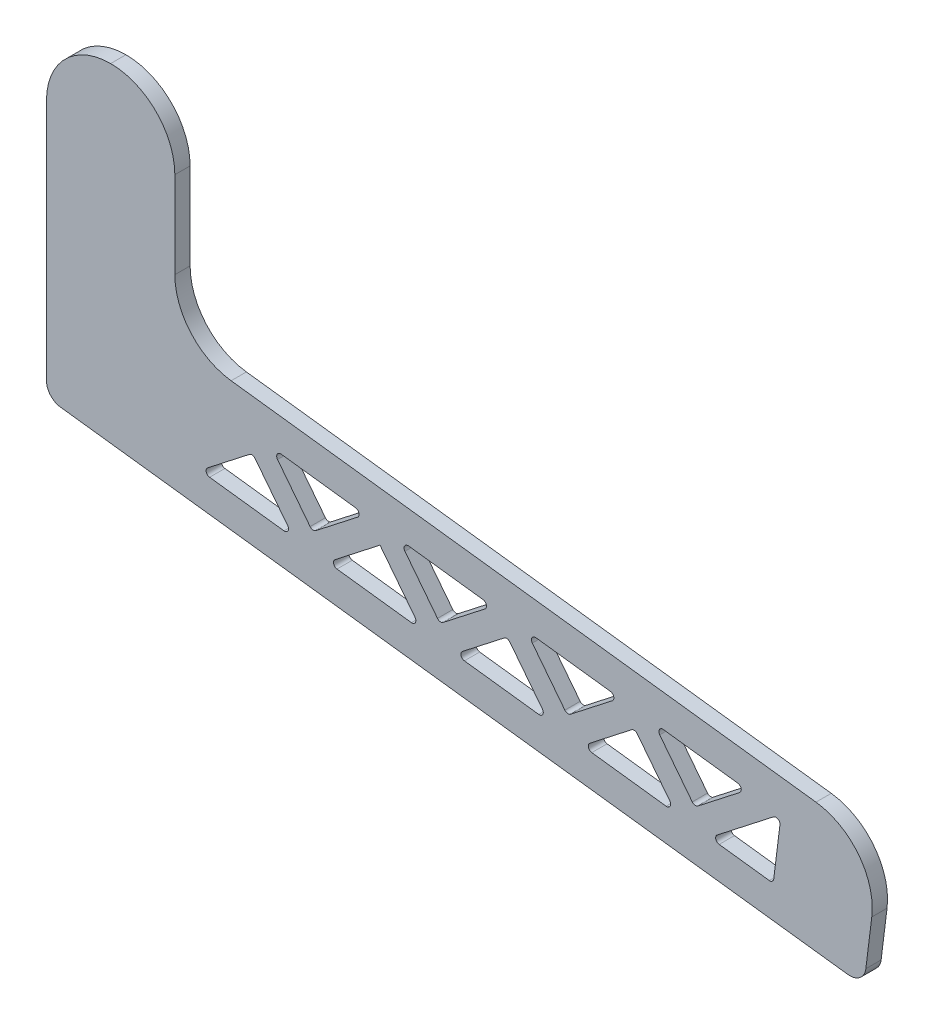
from build123d import *

# Parameters (mm, degrees)
SKETCH1_R           = 7.9375
SKETCH1_R_2         = 4.7879
BOSS_EXTRUDE1_DEPTH = 4.7625
FILLET3_R           = 40
FILLET4_R           = 10
CUT_EXTRUDE1_DEPTH  = 10
FILLET5_R           = 2.5
SKETCH30_R          = 7.9375
SKETCH30_R_2        = 4.7879
BOSS_EXTRUDE2_DEPTH = 9.525


with BuildPart() as part:
    # Sketch1 → Boss-Extrude1 (new, symmetric)
    with BuildSketch(Plane.XY):
        Polygon((-144.07836487, 49.742763384), (-144.07836487, -50.257236616), (365.353249064, -113.421723532), (375.197079951, -34.029664776), (-64.07836487, 20.436150317), (-64.07836487, 149.742763384), (-144.07836487, 149.742763384), align=None)
        with Locations(Location((-104.07836487, 109.742763384, 0), (0, 0, 180))):
            Circle(SKETCH1_R, mode=Mode.SUBTRACT)
        with Locations(Location((330.57913513, -68.80377871, 0), (0, 0, 180))):
            Circle(SKETCH1_R_2, mode=Mode.SUBTRACT)
    extrude(amount=BOSS_EXTRUDE1_DEPTH, both=True)

    # Fillet3
    fillet3_edges = [part.edges().sort_by_distance(p)[0] for p in [
        (-64.07836487, 20.436150317, 0),
        (-64.07836487, 149.742763384, 0),
        (-144.07836487, 149.742763384, 0),
        (375.197079951, -34.029664776, 0),
    ]]
    fillet(fillet3_edges, radius=FILLET3_R - 0.0001)  # a hair under: the kernel refuses the full size

    # Fillet4
    fillet4_edges = [part.edges().sort_by_distance(p)[0] for p in [
        (365.353249064, -113.421723532, 0),
        (-144.07836487, -50.257236616, 0),
    ]]
    fillet(fillet4_edges, radius=FILLET4_R)

    # Sketch16 → Cut-Extrude1 (cut)
    with BuildSketch(Plane.XY.offset(4.7625)):
        Polygon((54.565895217, -14.427714854), (-3.774164869, -7.194123807), (21.77906965, -39.980949374), align=None)
        Polygon((-15.605284124, -16.415003221), (-48.392109691, -41.968237741), (9.947950395, -49.201828788), align=None)
        Polygon((133.957953972, -24.271545742), (75.617893886, -17.037954695), (101.171128405, -49.824780261), align=None)
        Polygon((63.786774631, -26.258834109), (30.999949065, -51.812068628), (89.340009151, -59.045659676), align=None)
        Polygon((213.350012728, -34.11537663), (155.009952642, -26.881785582), (180.563187161, -59.668611149), align=None)
        Polygon((143.178833387, -36.102664997), (110.39200782, -61.655899516), (168.732067906, -68.889490564), align=None)
        Polygon((292.742071484, -43.959207518), (234.402011397, -36.72561647), (259.955245917, -69.512442037), align=None)
        Polygon((222.570892143, -45.946495885), (189.784066576, -71.499730404), (248.124126662, -78.733321452), align=None)
        Polygon((313.794070153, -46.569447358), (269.176125331, -81.343561292), (308.872154709, -86.265476736), align=None)
    extrude(amount=-CUT_EXTRUDE1_DEPTH, mode=Mode.SUBTRACT)

    # Fillet5
    fillet5_edges = [part.edges().sort_by_distance(p)[0] for p in [
        (110.39200782, -61.655899516, 0),
        (143.178833387, -36.102664997, 0),
        (168.732067906, -68.889490564, 0),
        (292.742071484, -43.959207518, 0),
        (259.955245917, -69.512442037, 0),
        (234.402011397, -36.72561647, 0),
        (189.784066576, -71.499730404, 0),
        (222.570892143, -45.946495885, 0),
        (248.124126662, -78.733321452, 0),
        (-48.392109691, -41.968237741, 0),
        (-15.605284124, -16.415003221, 0),
        (9.947950395, -49.201828788, 0),
        (30.999949065, -51.812068628, 0),
        (89.340009151, -59.045659676, 0),
        (54.565895217, -14.427714854, 0),
        (21.77906965, -39.980949374, 0),
        (-3.774164869, -7.194123807, 0),
        (133.957953972, -24.271545742, 0),
        (101.171128405, -49.824780261, 0),
        (75.617893886, -17.037954695, 0),
        (269.176125331, -81.343561292, 0),
        (313.794070153, -46.569447358, 0),
        (308.872154709, -86.265476736, 0),
        (213.350012728, -34.11537663, 0),
        (180.563187161, -59.668611149, 0),
        (155.009952642, -26.881785582, 0),
    ]]
    fillet(fillet5_edges, radius=FILLET5_R)

    # Sketch30 → Boss-Extrude2 (add)
    with BuildSketch(Plane(origin=(0, 0, -4.7625), x_dir=(-1, 0, 0), z_dir=(0, 0, -1))):
        with Locations((104.07836487, 109.742763384)):
            Circle(SKETCH30_R)
        with Locations((-330.57913513, -68.80377871)):
            Circle(SKETCH30_R_2)
    extrude(amount=-BOSS_EXTRUDE2_DEPTH)


solid = part.part
